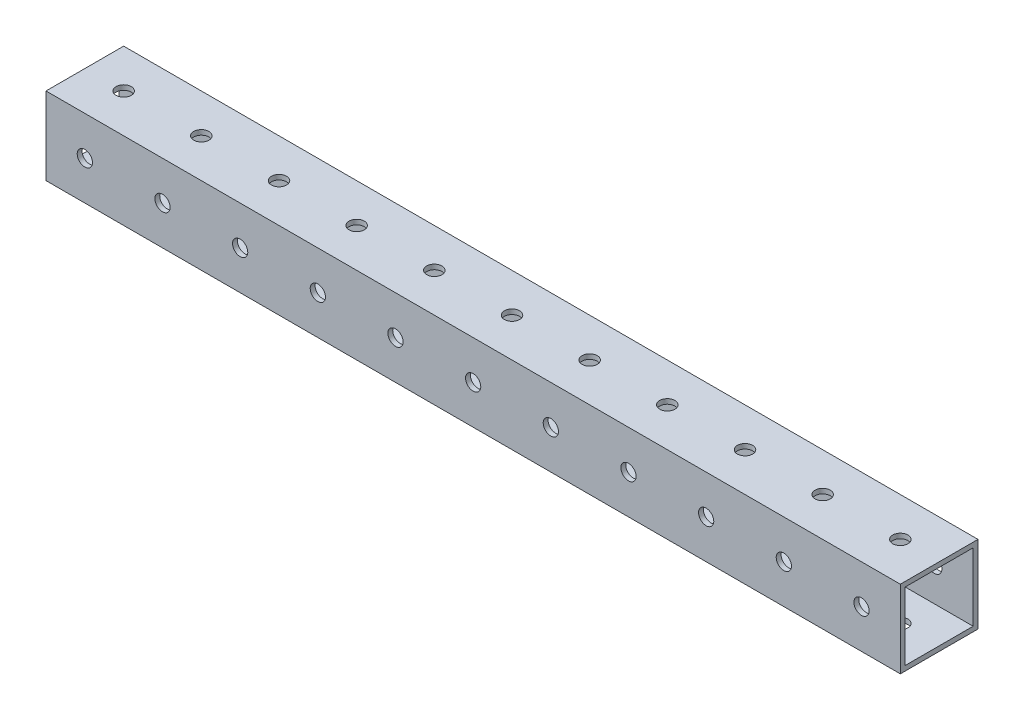
from build123d import *

# Parameters (mm, degrees)
SKETCH1_W             = 25.4
SKETCH1_H             = 25.4
SKETCH1_W_2           = 22.225
SKETCH1_H_2           = 22.225
BOSS_EXTRUDE1_DEPTH   = 139.7
SKETCH3_W             = 2.4892
SKETCH3_H             = 25.4
SKETCH3_AT_POINT_2_W  = 2.4892
SKETCH3_AT_POINT_2_H  = 25.4
LPATTERN1_START       = -12.7
LPATTERN1_OUTLINE_R   = 2.4892
LPATTERN1_DEPTH       = 25.4
LPATTERN1_2_OUTLINE_R = 2.4892
LPATTERN1_2_DEPTH     = 25.4


# Read off the part's stored shape, not the designer's step: LPattern1
with BuildPart() as part:
    # Sketch1 → Boss-Extrude1 (new, symmetric)
    with BuildSketch(Plane(origin=(0, 0, 0), x_dir=(0, 0, -1), z_dir=(1, 0, 0))):
        Rectangle(SKETCH1_W, SKETCH1_H)
        Rectangle(SKETCH1_W_2, SKETCH1_H_2, mode=Mode.SUBTRACT)
    extrude(amount=BOSS_EXTRUDE1_DEPTH, both=True)

    # Sketch3 → #9 (0.196) Diameter Hole1 (revolve, cut)
    with BuildSketch(Plane(origin=(127, 12.7, 0), x_dir=(0, 0, 1), z_dir=(1, 0, 0))):
        with Locations((1.2446, 12.7)):
            Rectangle(SKETCH3_W, SKETCH3_H)
    revolve(axis=Axis((127, 19.05, 0), (0, -1, 0)), mode=Mode.SUBTRACT)

    # Sketch3 at point 2 (carried to point 2, square into its face) → #9 (0.196) Diameter Hole1 at 2 (revolve, cut)
    with BuildSketch(Plane(origin=(127, 0, 12.7), x_dir=(0, -1, 0), z_dir=(1, 0, 0))):
        with Locations((1.2446, 12.7)):
            Rectangle(SKETCH3_AT_POINT_2_W, SKETCH3_AT_POINT_2_H)
    revolve(axis=Axis((127, 0, 19.05), (0, 0, -1)), mode=Mode.SUBTRACT)

    # LPattern1 outline → LPattern1 (cut)
    with BuildSketch(Plane.XY.offset(LPATTERN1_START)):
        with Locations((101.6, 0)):
            Circle(LPATTERN1_OUTLINE_R)
        with Locations((76.2, 0)):
            Circle(LPATTERN1_OUTLINE_R)
        with Locations((50.8, 0)):
            Circle(LPATTERN1_OUTLINE_R)
        with Locations((25.4, 0)):
            Circle(LPATTERN1_OUTLINE_R)
        Circle(LPATTERN1_OUTLINE_R)
        with Locations((-25.4, 0)):
            Circle(LPATTERN1_OUTLINE_R)
        with Locations((-50.8, 0)):
            Circle(LPATTERN1_OUTLINE_R)
        with Locations((-76.2, 0)):
            Circle(LPATTERN1_OUTLINE_R)
        with Locations((-101.6, 0)):
            Circle(LPATTERN1_OUTLINE_R)
        with Locations((-127, 0)):
            Circle(LPATTERN1_OUTLINE_R)
    extrude(amount=LPATTERN1_DEPTH, mode=Mode.SUBTRACT)

    # LPattern1 2 outline → LPattern1 2 (cut)
    with BuildSketch(Plane(origin=(0, 0, 0), x_dir=(1, 0, 0), z_dir=(0, 1, 0)).offset(LPATTERN1_START)):
        with Locations((101.6, 0)):
            Circle(LPATTERN1_2_OUTLINE_R)
        with Locations((76.2, 0)):
            Circle(LPATTERN1_2_OUTLINE_R)
        with Locations((50.8, 0)):
            Circle(LPATTERN1_2_OUTLINE_R)
        with Locations((25.4, 0)):
            Circle(LPATTERN1_2_OUTLINE_R)
        Circle(LPATTERN1_2_OUTLINE_R)
        with Locations((-25.4, 0)):
            Circle(LPATTERN1_2_OUTLINE_R)
        with Locations((-50.8, 0)):
            Circle(LPATTERN1_2_OUTLINE_R)
        with Locations((-76.2, 0)):
            Circle(LPATTERN1_2_OUTLINE_R)
        with Locations((-101.6, 0)):
            Circle(LPATTERN1_2_OUTLINE_R)
        with Locations((-127, 0)):
            Circle(LPATTERN1_2_OUTLINE_R)
    extrude(amount=LPATTERN1_2_DEPTH, mode=Mode.SUBTRACT)


solid = part.part
